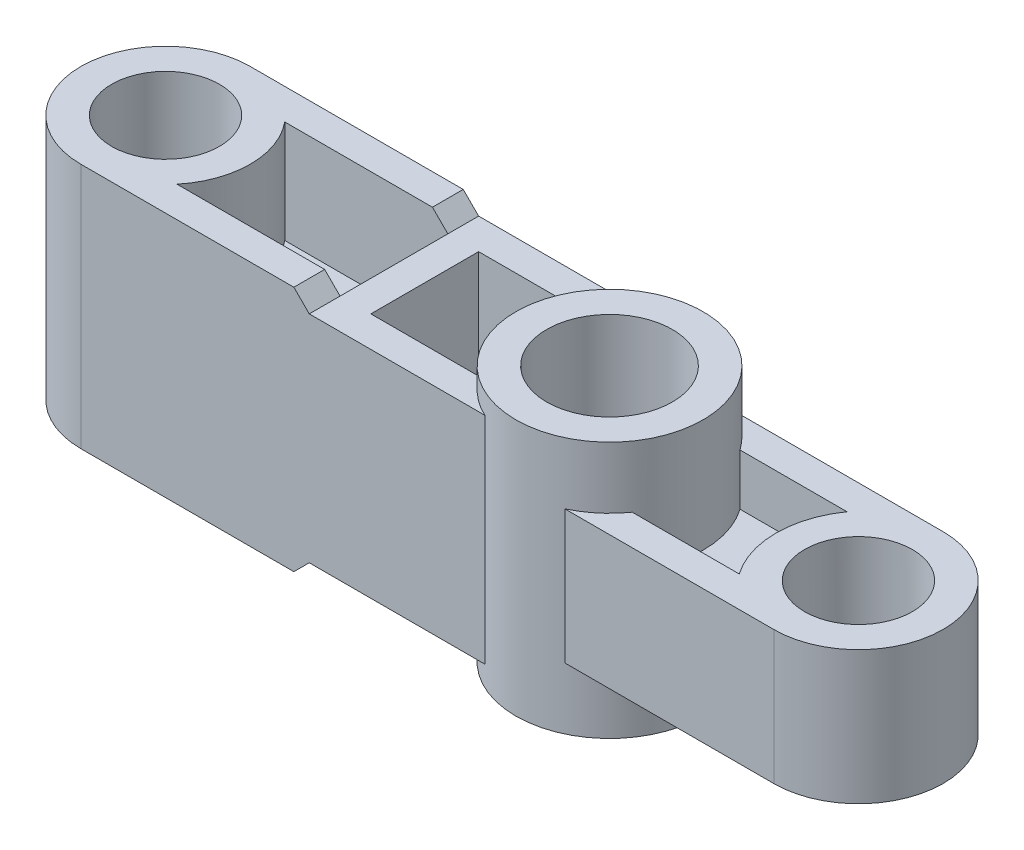
from build123d import *

# Parameters (mm, degrees)
BOSS_EXTRUDE1_DEPTH = 9.6
SKETCH2_R           = 2.1
CUT_EXTRUDE1_DEPTH  = 20.628805364
SKETCH3_R           = 3.65
BOSS_EXTRUDE5_DEPTH = 5
SKETCH3_4_R         = 2.45
CUT_EXTRUDE4_DEPTH  = 5
CUT_EXTRUDE5_DEPTH  = 0.6
CUT_EXTRUDE6_DEPTH  = 2.2
CUT_EXTRUDE7_DEPTH  = 2
CUT_EXTRUDE8_START  = -4
CUT_EXTRUDE8_DEPTH  = 4
CHAMFER1_SIZE       = 0.6
CUT_EXTRUDE9_DEPTH  = 20.498782013


with BuildPart() as part:
    # Sketch1 → Boss-Extrude1 (new body)
    with BuildSketch(Plane(origin=(0, 0, 0), x_dir=(1, 0, 0), z_dir=(0, 1, 0))):
        with BuildLine():
            ThreePointArc((13.5, 3.3), (16.8, 0), (13.5, -3.3))
            Line((13.5, -3.3), (-13.5, -3.3))
            ThreePointArc((-13.5, -3.3), (-16.8, 0), (-13.5, 3.3))
            Line((-13.5, 3.3), (13.5, 3.3))
        make_face()
    extrude(amount=BOSS_EXTRUDE1_DEPTH)

    # Sketch2 → Cut-Extrude1 (cut, through all)
    with BuildSketch(Plane(origin=(0, 9.6, 0), x_dir=(1, 0, 0), z_dir=(0, 1, 0))):
        with Locations(Location((-13.5, 0, 0), (0, 0, 270))):
            Circle(SKETCH2_R)
    cut_extrude1 = extrude(amount=-CUT_EXTRUDE1_DEPTH, mode=Mode.SUBTRACT)

    # Mirror1: Cut-Extrude1 across plane
    add(cut_extrude1.mirror(Plane(origin=(0, 0, 0), x_dir=(0, 0, 1), z_dir=(1, 0, 0))), mode=Mode.SUBTRACT)

    # Sketch3 → Boss-Extrude5 (add, symmetric)
    with BuildSketch(Plane(origin=(0, 4.8, 0), x_dir=(1, 0, 0), z_dir=(0, 1, 0))):
        with Locations(Location((3.8, 0, 0), (0, 0, 270))):
            Circle(SKETCH3_R)
    extrude(amount=BOSS_EXTRUDE5_DEPTH, both=True)

    # Sketch3<4> → Cut-Extrude4 (cut, symmetric)
    with BuildSketch(Plane(origin=(0, 4.8, 0), x_dir=(1, 0, 0), z_dir=(0, 1, 0))):
        with Locations(Location((3.8, 0, 0), (0, 0, 270))):
            Circle(SKETCH3_4_R)
    extrude(amount=CUT_EXTRUDE4_DEPTH, both=True, mode=Mode.SUBTRACT)

    # Sketch6 → Cut-Extrude5 (cut)
    with BuildSketch(Plane(origin=(0, 9.6, 0), x_dir=(1, 0, 0), z_dir=(0, 1, 0))):
        with BuildLine():
            Line((-4.6, 3.3), (-4.6, -3.3))
            Line((-4.6, -3.3), (2.240352604, -3.3))
            ThreePointArc((2.240352604, -3.3), (0.15, 0), (2.240352604, 3.3))
            Line((2.240352604, 3.3), (-4.6, 3.3))
        make_face()
    cut_extrude5 = extrude(amount=-CUT_EXTRUDE5_DEPTH, mode=Mode.SUBTRACT)

    # Mirror2: Cut-Extrude5 across plane
    add(cut_extrude5.mirror(Plane.ZX.offset(4.8)), mode=Mode.SUBTRACT)

    # Sketch8 → Cut-Extrude6 (cut)
    with BuildSketch(Plane.XZ):
        with BuildLine():
            Line((13.5, 3.3), (5.359647396, 3.3))
            ThreePointArc((5.359647396, 3.3), (7.45, 0), (5.359647396, -3.3))
            Line((5.359647396, -3.3), (13.5, -3.3))
            ThreePointArc((13.5, -3.3), (16.8, 0), (13.5, 3.3))
        make_face()
    cut_extrude6 = extrude(amount=-CUT_EXTRUDE6_DEPTH, mode=Mode.SUBTRACT)

    # Mirror3: Cut-Extrude6 across plane
    add(cut_extrude6.mirror(Plane.ZX.offset(4.8)), mode=Mode.SUBTRACT)

    # Sketch9 → Cut-Extrude7 (cut)
    with BuildSketch(Plane(origin=(0, 7.4, 0), x_dir=(1, 0, 0), z_dir=(0, 1, 0))):
        with BuildLine():
            Line((6.785381048, 2.1), (10.954415588, 2.1))
            ThreePointArc((10.954415588, 2.1), (10.289796635, 0), (10.954415588, -2.1))
            Line((10.954415588, -2.1), (6.785381048, -2.1))
            ThreePointArc((6.785381048, -2.1), (7.45, 0), (6.785381048, 2.1))
        make_face()
    cut_extrude7 = extrude(amount=-CUT_EXTRUDE7_DEPTH, mode=Mode.SUBTRACT)

    # Mirror4: Cut-Extrude7 across plane
    add(cut_extrude7.mirror(Plane.ZX.offset(4.8)), mode=Mode.SUBTRACT)

    # Sketch11 → Cut-Extrude8 (cut)
    with BuildSketch(Plane(origin=(0, 9.6, 0), x_dir=(1, 0, 0), z_dir=(0, 1, 0)).offset(CUT_EXTRUDE8_START)):
        with BuildLine():
            Line((-10.954415588, 2.1), (-4.6, 2.1))
            Line((-4.6, 2.1), (-4.6, -2.1))
            Line((-4.6, -2.1), (-10.954415588, -2.1))
            ThreePointArc((-10.954415588, -2.1), (-10.2, 0), (-10.954415588, 2.1))
        make_face()
    cut_extrude8 = extrude(amount=CUT_EXTRUDE8_DEPTH, mode=Mode.SUBTRACT)

    # Mirror7: Cut-Extrude8 across plane
    add(cut_extrude8.mirror(Plane.ZX.offset(4.8)), mode=Mode.SUBTRACT)

    # Chamfer1
    chamfer1_edges = [part.edges().sort_by_distance(p)[0] for p in [
        (-4.6, 9.6, 2.7),
        (-4.6, 9.6, -2.7),
        (-4.6, 0, -2.7),
        (-4.6, 0, 2.7),
    ]]
    chamfer(chamfer1_edges, length=CHAMFER1_SIZE - 0.0001)  # a hair under: the kernel refuses the full size

    # Sketch13 → Cut-Extrude9 (cut, through all)
    with BuildSketch(Plane(origin=(0, 9, 0), x_dir=(1, 0, 0), z_dir=(0, 1, 0))):
        with BuildLine():
            Line((0.814618952, -2.1), (-3.4, -2.1))
            Line((-3.4, -2.1), (-3.4, 2.1))
            Line((-3.4, 2.1), (0.814618952, 2.1))
            ThreePointArc((0.814618952, 2.1), (0.15, 0), (0.814618952, -2.1))
        make_face()
    extrude(amount=-CUT_EXTRUDE9_DEPTH, mode=Mode.SUBTRACT)


solid = part.part
